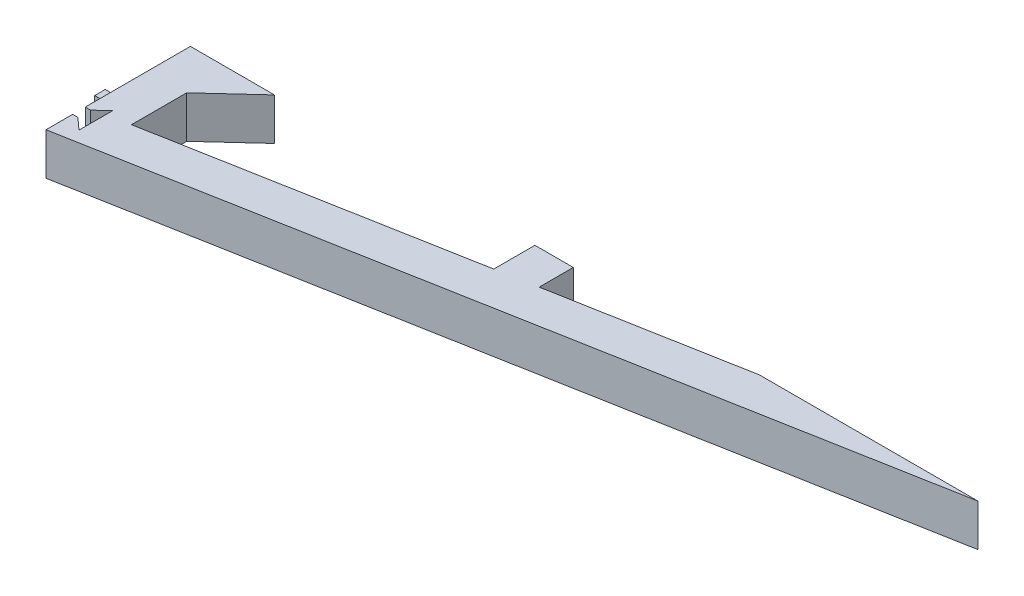
from build123d import *

# Parameters (mm, degrees)
P_IDAT_VYSUNUT_M1_DEPTH  = 8
ODEBRAT_VYSUNUT_M1_DEPTH = 153.557332159
SKICA3_W                 = 2
SKICA3_H                 = 2
P_IDAT_VYSUNUT_M2_DEPTH  = 4
SKICA5_W                 = 16
SKICA5_H                 = 8
P_IDAT_VYSUNUT_M4_DEPTH  = 8
ODEBRAT_VYSUNUT_M3_DEPTH = 153.557332159
SKICA8_R                 = 2.2
ODEBRAT_VYSUNUT_M4_DEPTH = 2.4
SKICA9_R                 = 1.85
ODEBRAT_VYSUNUT_M5_DEPTH = 7


with BuildPart() as part:
    # Skica1 → Přidat vysunutím1 (new body)
    with BuildSketch(Plane(origin=(0, 0, 0), x_dir=(1, 0, 0), z_dir=(0, 1, 0))):
        Polygon((0, 0), (0, -27.47211487), (149.85, 0.000769495), (108.259653873, 0.000769495), (72.85, -6.491091207), (72.85, 0), (65.55, 0), (65.55, -7.829443265), (7.3, -18.508759343), (7.3, 0), align=None)
    extrude(amount=P_IDAT_VYSUNUT_M1_DEPTH)

    # Skica2 → Odebrat vysunutím1 (cut, through all)
    with BuildSketch(Plane(origin=(0, 8, 0), x_dir=(1, 0, 0), z_dir=(0, 1, 0))):
        Polygon((0, -20), (1, -20), (3.2, -18), (3.2, -24.4), (1, -22.4), (0, -22.4), align=None)
    extrude(amount=-ODEBRAT_VYSUNUT_M1_DEPTH, mode=Mode.SUBTRACT)

    # Skica3 → Přidat vysunutím2 (add)
    with BuildSketch(Plane.ZY):
        with Locations((13.2, 4)):
            Rectangle(SKICA3_W, SKICA3_H)
    extrude(amount=P_IDAT_VYSUNUT_M2_DEPTH)

    # Skica5 → Přidat vysunutím4 (add)
    with BuildSketch(Plane(origin=(0, 8, 0), x_dir=(1, 0, 0), z_dir=(0, 1, 0))):
        with Locations((8, -4)):
            Rectangle(SKICA5_W, SKICA5_H)
    extrude(amount=-P_IDAT_VYSUNUT_M4_DEPTH)

    # Skica7 → Odebrat vysunutím3 (cut, through all)
    with BuildSketch(Plane.XZ):
        Polygon((7.3, 8), (16, 8), (16, 0), align=None)
    extrude(amount=-ODEBRAT_VYSUNUT_M3_DEPTH, mode=Mode.SUBTRACT)

    # Skica8 → Odebrat vysunutím4 (cut)
    with BuildSketch(Plane(origin=(0, 0, 0), x_dir=(-1, 0, 0), z_dir=(0, 0, -1))):
        with Locations((-3.65, 4)):
            Circle(SKICA8_R)
        with Locations((-69.2, 4)):
            Circle(SKICA8_R)
    extrude(amount=-ODEBRAT_VYSUNUT_M4_DEPTH, mode=Mode.SUBTRACT)

    # Skica9 → Odebrat vysunutím5 (cut)
    with BuildSketch(Plane(origin=(0, 0, 2.4), x_dir=(-1, 0, 0), z_dir=(0, 0, -1))):
        with Locations((-69.2, 4)):
            Circle(SKICA9_R)
        with Locations((-3.65, 4)):
            Circle(SKICA9_R)
    extrude(amount=-ODEBRAT_VYSUNUT_M5_DEPTH, mode=Mode.SUBTRACT)


solid = part.part
